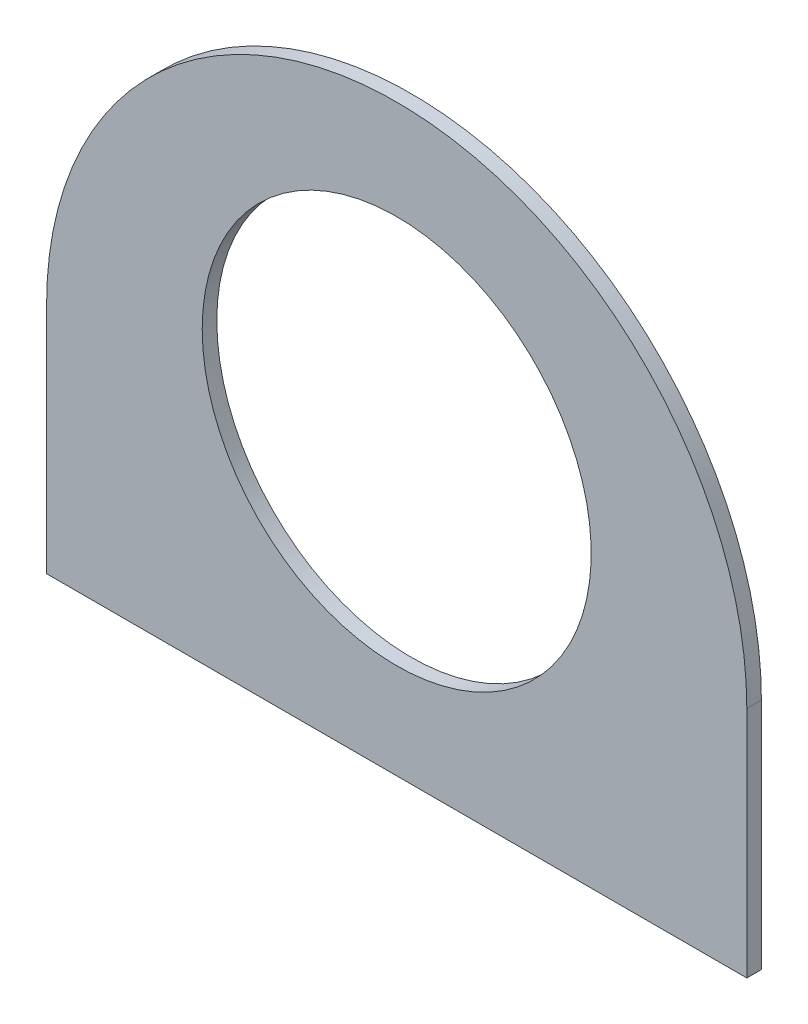
from build123d import *

# Parameters (mm, degrees)
SKETCH1_R           = 127
BOSS_EXTRUDE1_DEPTH = 9.525


with BuildPart() as part:
    # Sketch1 → Boss-Extrude1 (new body)
    with BuildSketch(Plane.XY):
        with BuildLine():
            Line((-228.6, -36.83), (-228.6, -189.23))
            Line((-228.6, -189.23), (228.6, -189.23))
            Line((228.6, -189.23), (228.6, -36.83))
            ThreePointArc((228.6, -36.83), (0, 191.77), (-228.6, -36.83))
        make_face()
        Circle(SKETCH1_R, mode=Mode.SUBTRACT)
    extrude(amount=BOSS_EXTRUDE1_DEPTH)


solid = part.part
